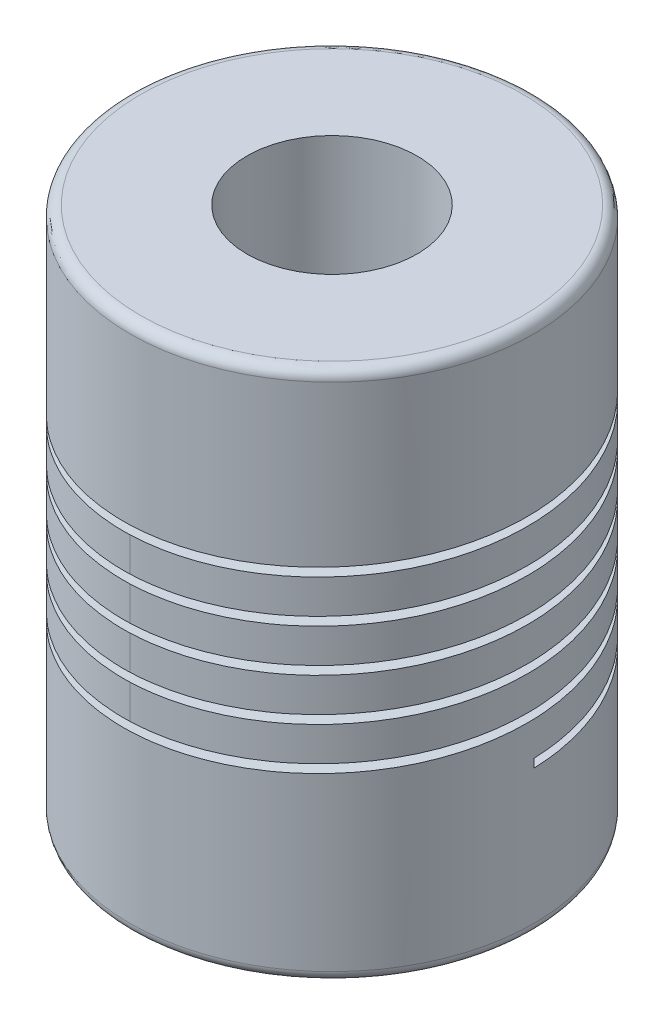
from build123d import *

# Parameters (mm, degrees)
SKETCH1_R           = 9.5
SKETCH1_R_2         = 2.5
BOSS_EXTRUDE1_DEPTH = 25
SKETCH2_R           = 4
CUT_EXTRUDE1_DEPTH  = 18
FILLET1_R           = 0.5
CUT_SWEEP2_PITCH    = 2


with BuildPart() as part:
    # Sketch1 → Boss-Extrude1 (new body)
    with BuildSketch(Plane(origin=(0, 0, 0), x_dir=(1, 0, 0), z_dir=(0, 1, 0))):
        with Locations(Location((0, 0, 0), (0, 0, 270))):
            Circle(SKETCH1_R)
        with Locations(Location((0, 0, 0), (0, 0, 270))):
            Circle(SKETCH1_R_2, mode=Mode.SUBTRACT)
    extrude(amount=BOSS_EXTRUDE1_DEPTH)

    # Sketch2 → Cut-Extrude1 (cut)
    with BuildSketch(Plane(origin=(0, 25, 0), x_dir=(1, 0, 0), z_dir=(0, 1, 0))):
        with Locations(Location((0, 0, 0), (0, 0, 270))):
            Circle(SKETCH2_R)
    extrude(amount=-CUT_EXTRUDE1_DEPTH, mode=Mode.SUBTRACT)

    # Fillet1
    fillet1_edges = [part.edges().sort_by_distance(p)[0] for p in [
        (0, 0, -9.5),
        (0, 25, -9.5),
    ]]
    fillet(fillet1_edges, radius=FILLET1_R)

    # Cut-Sweep2: the profile of Sketch4 profile screwed along a right-hand helix of 5.5 turns, 10 arcs to a turn; built about Z, then put on its axis
    cut_sweep2_z = Axis((0, 0, 0), (0, 0, 1))
    cut_sweep2_corners = [(9.5003, 0, -0.222234504), (2.5, 0, 0), (9.5003, 0, 0.177782639)]
    with BuildLine(mode=Mode.PRIVATE) as cut_sweep2_profile:
        Line(cut_sweep2_corners[0], cut_sweep2_corners[1])
        Line(cut_sweep2_corners[1], cut_sweep2_corners[2])
        Line(cut_sweep2_corners[2], cut_sweep2_corners[0])
    cut_sweep2_cap = Face(cut_sweep2_profile.wire())
    cut_sweep2_turn_angles = [0, 18, 36, 54, 72, 90, 108, 126, 144, 162, 180, 198, 216, 234, 252, 270, 288, 306, 324, 342, 360]
    cut_sweep2_turn_weights = [1, 0.9510565162951535, 1, 0.9510565162951535, 1, 0.9510565162951535, 1, 0.9510565162951535, 1, 0.9510565162951535, 1, 0.9510565162951535, 1, 0.9510565162951535, 1, 0.9510565162951535, 1, 0.9510565162951535, 1, 0.9510565162951535, 1]
    cut_sweep2_turn_rails = [Edge.make_bspline([Vector(p[0], p[1], 0).rotate(cut_sweep2_z, cut_sweep2_turn_angles[k]) / cut_sweep2_turn_weights[k] + Vector(0, 0, p[2] + CUT_SWEEP2_PITCH * cut_sweep2_turn_angles[k] / 360) for k in range(21)], [0, 0, 0, 1, 1, 2, 2, 3, 3, 4, 4, 5, 5, 6, 6, 7, 7, 8, 8, 9, 9, 10, 10, 10], 2, cut_sweep2_turn_weights) for p in cut_sweep2_corners]
    cut_sweep2_turn_sides = [Face.make_surface_from_curves(cut_sweep2_turn_rails[p[0]], cut_sweep2_turn_rails[p[1]]) for p in [(0, 1), (1, 2), (2, 0)]]
    cut_sweep2_last_angles = [1800, 1818, 1836, 1854, 1872, 1890, 1908, 1926, 1944, 1962, 1980]
    cut_sweep2_last_weights = [1, 0.9510565162951535, 1, 0.9510565162951535, 1, 0.9510565162951535, 1, 0.9510565162951535, 1, 0.9510565162951401, 1]
    cut_sweep2_last_rails = [Edge.make_bspline([Vector(p[0], p[1], 0).rotate(cut_sweep2_z, cut_sweep2_last_angles[k]) / cut_sweep2_last_weights[k] + Vector(0, 0, p[2] + CUT_SWEEP2_PITCH * cut_sweep2_last_angles[k] / 360) for k in range(11)], [0, 0, 0, 1, 1, 2, 2, 3, 3, 4, 4, 5, 5, 5], 2, cut_sweep2_last_weights) for p in cut_sweep2_corners]
    cut_sweep2_last_sides = [Face.make_surface_from_curves(cut_sweep2_last_rails[p[0]], cut_sweep2_last_rails[p[1]]) for p in [(0, 1), (1, 2), (2, 0)]]
    cut_sweep2 = Plane(origin=(0, 18, 0), x_dir=(-1, 0, 0), z_dir=(0, -1, 0)) * Solid(Shell([*[p.moved(Location((0, 0, CUT_SWEEP2_PITCH * i))) for i in range(5) for p in cut_sweep2_turn_sides], *cut_sweep2_last_sides, cut_sweep2_cap, cut_sweep2_cap.rotate(cut_sweep2_z, 1980).moved(Location((0, 0, CUT_SWEEP2_PITCH * 1980 / 360)))]))
    add(cut_sweep2, mode=Mode.SUBTRACT)


solid = part.part
